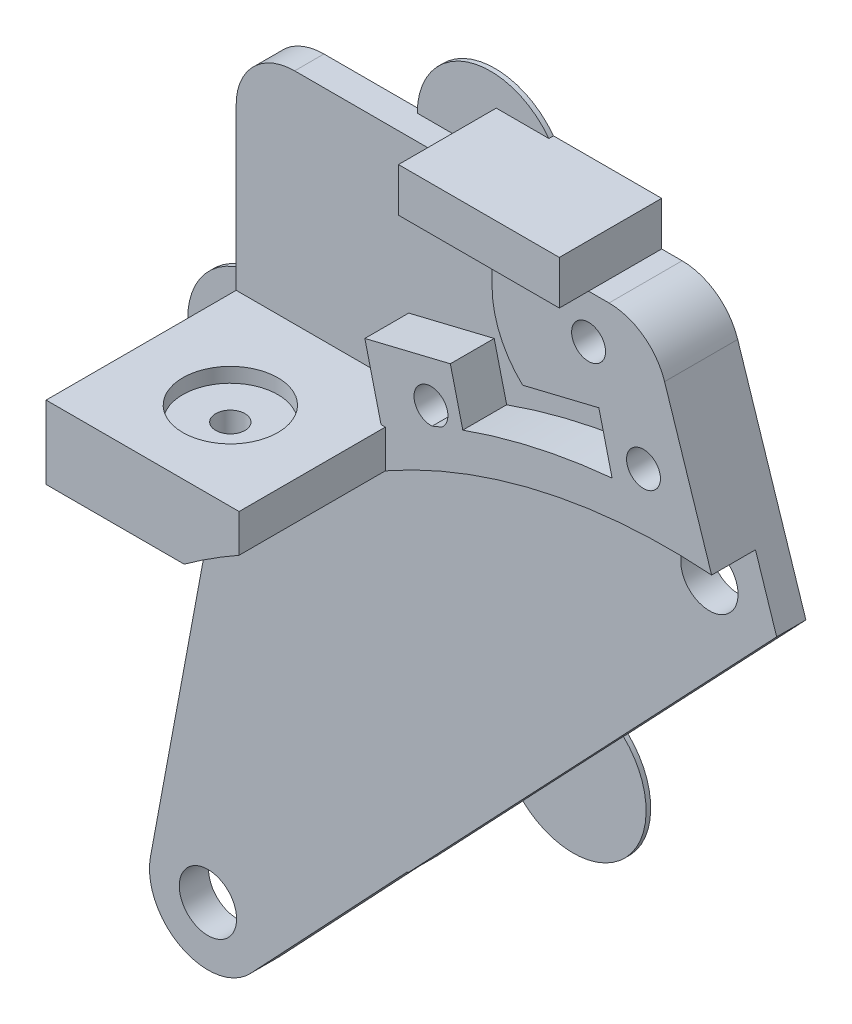
from build123d import *

# Parameters (mm, degrees)
SKETCH2_R                = 3.81
BOSS_EXTRUDE1_DEPTH      = 2.54
SKETCH5_W                = 16.764
SKETCH5_H                = 6.35
BOSS_EXTRUDE2_DEPTH      = 16.51
SKETCH6_R                = 4.1275
CUT_EXTRUDE2_DEPTH       = 1.27
SKETCH7_R                = 1.27
CUT_EXTRUDE3_DEPTH       = 80.197102245
CUT_EXTRUDE4_DEPTH       = 2.286
BOSS_EXTRUDE3_DEPTH      = 3.81
F_4_CLEARANCE_HOLE1_D    = 2.9464
BOSS_EXTRUDE6_DEPTH      = 6.35
BOSS_EXTRUDE6_DEPTH_BACK = 2.54
SKETCH14_W               = 13.97
SKETCH14_H               = 3.81
FILLET1_R                = 5.08
CUT_EXTRUDE5_DEPTH       = 83.859689862
CUT_EXTRUDE5_DEPTH_BACK  = 83.859689862
SKETCH19_R               = 2.4892
BOSS_EXTRUDE8_DEPTH      = 2.54
CUT_EXTRUDE8_DEPTH       = 2.54
BOSS_EXTRUDE7_DEPTH      = 3.81
CUT_EXTRUDE7_DEPTH       = 87.868867767
SKETCH13_R               = 6.35
PRINT_TABS_DEPTH         = 0.4


# Read off the part's stored shape, not the designer's step: Boss-Extrude7
with BuildPart() as part:
    # Sketch2 → Boss-Extrude1 (new body)
    with BuildSketch(Plane.XY):
        with BuildLine():
            Line((-17.068825413, -8.459178389), (-41.402, 40.64))
            Line((-41.402, 40.64), (-41.402, 66.04))
            Line((-41.402, 66.04), (-1.524, 66.04))
            Line((-1.524, 66.04), (18.109053667, 5.913093546))
            ThreePointArc((18.109053667, 5.913093546), (7.204933647, -17.634949139), (-17.068825413, -8.459178389))
        make_face()
        Circle(SKETCH2_R, mode=Mode.SUBTRACT)
    extrude(amount=BOSS_EXTRUDE1_DEPTH)

    # Sketch5 → Boss-Extrude2 (add)
    with BuildSketch(Plane.XY.offset(2.54)):
        with Locations((-33.02, 43.815)):
            Rectangle(SKETCH5_W, SKETCH5_H)
    extrude(amount=BOSS_EXTRUDE2_DEPTH)

    # Sketch6 → Cut-Extrude2 (cut)
    with BuildSketch(Plane(origin=(0, 46.99, 0), x_dir=(1, 0, 0), z_dir=(0, 1, 0))):
        with Locations(Location((-33.02, -11.43, 0), (0, 0, 270))):
            Circle(SKETCH6_R)
    extrude(amount=-CUT_EXTRUDE2_DEPTH, mode=Mode.SUBTRACT)

    # Sketch7 → Cut-Extrude3 (cut, through all)
    with BuildSketch(Plane(origin=(0, 45.72, 0), x_dir=(1, 0, 0), z_dir=(0, 1, 0))):
        with Locations(Location((-33.02, -11.43, 0), (0, 0, 270))):
            Circle(SKETCH7_R)
    extrude(amount=-CUT_EXTRUDE3_DEPTH, mode=Mode.SUBTRACT)

    # Sketch9 → Cut-Extrude4 (cut)
    with BuildSketch(Plane(origin=(0, 0, 0), x_dir=(-1, 0, 0), z_dir=(0, 0, -1))):
        Polygon((3.171122265, 62.23), (5.077532854, 58.928), (8.890354032, 58.928), (10.796764621, 62.23), (8.890354032, 65.532), (5.077532854, 65.532), align=None)
        Polygon((24.379877895, 49.663956202), (23.308143816, 53.323053276), (19.603405755, 54.224452874), (16.970401774, 51.466755398), (18.042135853, 47.807658324), (21.746873914, 46.906258726), align=None)
        Polygon((5.918476139, 54.15579827), (4.846742059, 57.814895344), (1.142003999, 58.716294942), (-1.490999983, 55.958597466), (-0.419265903, 52.299500392), (3.285472157, 51.398100794), align=None)
    extrude(amount=-CUT_EXTRUDE4_DEPTH, mode=Mode.SUBTRACT)

    # Sketch8 → Boss-Extrude3 (add)
    with BuildSketch(Plane.XY.offset(2.54)):
        with BuildLine():
            Line((-15.367, 66.04), (-6.983943443, 66.04))
            Line((-6.983943443, 66.04), (-1.524, 66.04))
            Line((-1.524, 66.04), (3.09175139, 51.904101595))
            Line((3.09175139, 51.904101595), (-4.240438106, 50.120107003))
            Line((-4.240438106, 50.120107003), (-6.088713216, 57.716488409))
            Line((-6.088713216, 57.716488409), (-12.708473154, 56.10583501))
            ThreePointArc((-12.708473154, 56.10583501), (-14.673699407, 58.891843255), (-15.367, 62.23))
            Line((-15.367, 62.23), (-15.367, 66.04))
        make_face()
        Polygon((-17.142042414, 46.981018422), (-18.990317524, 54.577399829), (-26.415687706, 52.770733449), (-24.567412596, 45.174352043), align=None)
    extrude(amount=BOSS_EXTRUDE3_DEPTH)

    # #4 Clearance Hole1 (through all)
    with Locations(Plane.XY.offset(6.35)):
        with Locations((-6.983943443, 62.23), (-20.675139834, 50.5653558), (-2.213738078, 55.057197868)):
            Hole(F_4_CLEARANCE_HOLE1_D / 2)

    # Sketch14 → Boss-Extrude6 (add, two sides: drawn at the far end of the back side and taken through both)
    with BuildSketch(Plane.XY.offset(2.54).offset(-BOSS_EXTRUDE6_DEPTH_BACK)):
        with Locations((-13.968943443, 67.945)):
            Rectangle(SKETCH14_W, SKETCH14_H)
    extrude(amount=BOSS_EXTRUDE6_DEPTH + BOSS_EXTRUDE6_DEPTH_BACK)

    # Fillet1
    fillet1_edges = [part.edges().sort_by_distance(p)[0] for p in [
        (-41.402, 66.04, 1.27),
        (-1.524, 66.04, 3.175),
    ]]
    fillet(fillet1_edges, radius=FILLET1_R)

    # Sketch15 → Cut-Extrude5 (cut, two sides: drawn at the far end of the back side and taken through both)
    with BuildSketch(Plane.XY.offset(2.54).offset(-CUT_EXTRUDE5_DEPTH_BACK)):
        with BuildLine():
            ThreePointArc((-0.315167053, 48.411374113), (-18.310138041, 44.816284079), (-33.674369734, 34.782140486))
            ThreePointArc((-33.674369734, 34.782140486), (-33.731327517, 31.262340905), (-30.211527936, 31.205383122))
            ThreePointArc((-30.211527936, 31.205383122), (-16.427248714, 40.207684038), (-0.28275743, 43.433079608))
            ThreePointArc((-0.28275743, 43.433079608), (2.190185011, 45.938431672), (-0.315167053, 48.411374113))
        make_face()
    extrude(amount=CUT_EXTRUDE5_DEPTH + CUT_EXTRUDE5_DEPTH_BACK, mode=Mode.SUBTRACT)

    # Sketch19 → Boss-Extrude8 (add, through all)
    with BuildSketch(Plane.XY.offset(2.54)):
        with BuildLine():
            Line((5.466200245, 44.632269783), (-40.158007355, -3.769954845))
            ThreePointArc((-40.158007355, -3.769954845), (-46.15516131, -4.814733016), (-48.848797168, 0.64436424))
            Line((-48.848797168, 0.64436424), (-41.402, 40.64))
            Line((-41.402, 40.64), (3.09175139, 51.904101595))
            Line((3.09175139, 51.904101595), (5.466200245, 44.632269783))
        make_face()
        with Locations((-0.298962241, 45.92222686)):
            Circle(SKETCH19_R, mode=Mode.SUBTRACT)
        with Locations((-43.854625645, -0.285501773)):
            Circle(SKETCH19_R, mode=Mode.SUBTRACT)
    extrude(amount=-BOSS_EXTRUDE8_DEPTH)

    # Sketch20 → Cut-Extrude8 (cut)
    with BuildSketch(Plane.XY.offset(2.54)):
        Polygon((-40.158007355, -3.769954845), (10.729493517, 49.863783044), (48.07174347, 14.433588323), (-7.673080914, -44.319607422), align=None)
    extrude(amount=-CUT_EXTRUDE8_DEPTH, mode=Mode.SUBTRACT)

    # Boss-Extrude7 outline → Boss-Extrude7 (add)
    with BuildSketch(Plane.XY.offset(2.54)):
        with BuildLine():
            ThreePointArc((-19.720952416, 49.442927803), (-20.146011494, 49.271262362), (-20.56957647, 49.095942783))
            ThreePointArc((-20.56957647, 49.095942783), (-20.117584831, 49.201739043), (-19.720952416, 49.442927803))
        make_face()
        with BuildLine():
            ThreePointArc((-24.638, 43.697782335), (-21.550057665, 45.300355844), (-18.358466971, 46.685050235))
            Line((-18.358466971, 46.685050235), (-24.567412596, 45.174352043))
            Line((-24.567412596, 45.174352043), (-24.638, 45.464465155))
            Line((-24.638, 45.464465155), (-24.638, 43.697782335))
        make_face()
        with BuildLine():
            ThreePointArc((-4.941378488, 53.000960864), (-11.514519488, 51.97051967), (-17.907769463, 50.128144457))
            Line((-17.907769463, 50.128144457), (-17.178757335, 47.131916166))
            ThreePointArc((-17.178757335, 47.131916166), (-6.891074176, 49.689438734), (3.704334892, 50.028043416))
            Line((3.704334892, 50.028043416), (3.09175139, 51.904101595))
            Line((3.09175139, 51.904101595), (-4.240438106, 50.120107003))
            Line((-4.240438106, 50.120107003), (-4.941378488, 53.000960864))
        make_face()
    extrude(amount=BOSS_EXTRUDE7_DEPTH)

    # Sketch16 → Cut-Extrude7 (cut, through all)
    with BuildSketch(Plane.XY.offset(2.54)):
        with BuildLine():
            ThreePointArc((-0.326576563, 50.163936974), (-18.972991936, 46.4386994), (-34.893431388, 36.041305068))
            ThreePointArc((-34.893431388, 36.041305068), (-34.990492099, 30.043279251), (-28.992466282, 29.94621854))
            ThreePointArc((-28.992466282, 29.94621854), (-15.764394819, 38.585268717), (-0.271347919, 41.680516747))
            ThreePointArc((-0.271347919, 41.680516747), (3.942747872, 45.949841182), (-0.326576563, 50.163936974))
        make_face()
    extrude(amount=CUT_EXTRUDE7_DEPTH, mode=Mode.SUBTRACT)

    # Sketch13 → Print Tabs (add)
    with BuildSketch(Plane(origin=(0, 0, 0), x_dir=(-1, 0, 0), z_dir=(0, 0, -1))):
        with Locations((14.284313144, 23.500060577)):
            Circle(SKETCH13_R)
        with Locations((21.463, 66.04)):
            Circle(SKETCH13_R)
        with Locations((41.402, 40.64)):
            Circle(SKETCH13_R)
    extrude(amount=-PRINT_TABS_DEPTH)


solid = part.part
